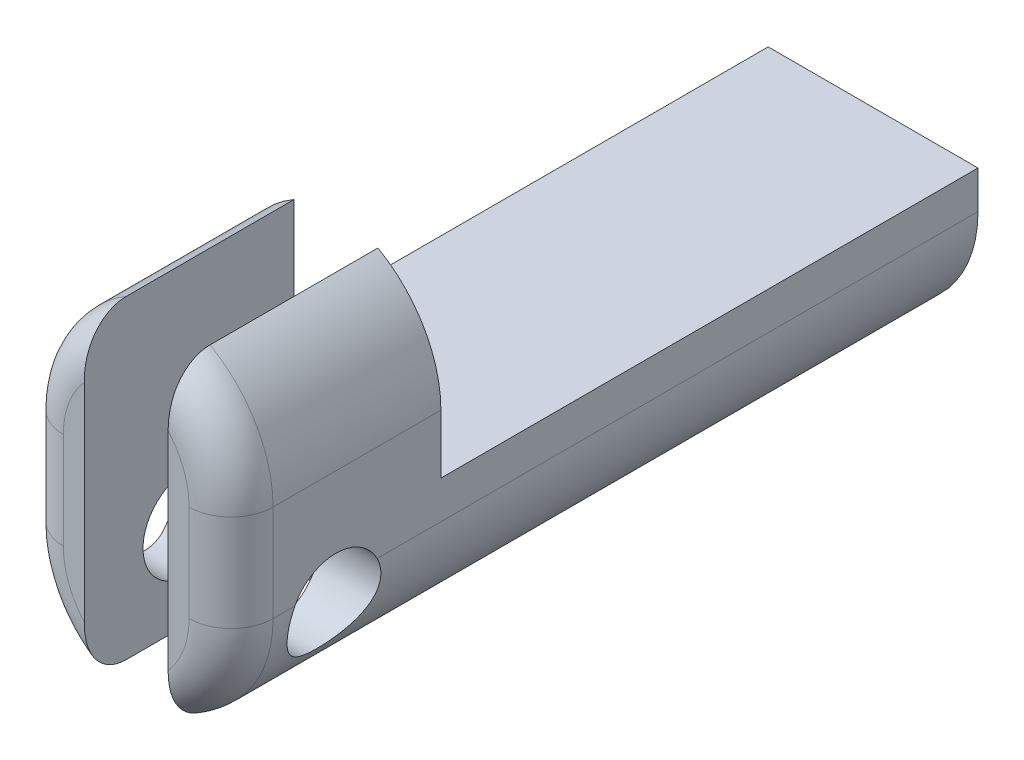
from build123d import *

# Parameters (mm, degrees)
SKETCH_1_W          = 5
SKETCH_1_H          = 3.9
EXTRUDE_1_DEPTH     = 12.8
SKETCH_2_R          = 1
CUT_EXTRUDE_1_DEPTH = 5
SKETCH_3_W          = 1.5
SKETCH_3_H          = 7.9
EXTRUDE_2_DEPTH     = 5
SKETCH_4_R          = 1.1
CUT_EXTRUDE_2_DEPTH = 5
FILLET_1_R          = 3
FILLET_2_R          = 3
FILLET_3_R          = 1


with BuildPart() as part:
    # 草图1 → 凸台-拉伸1 (new body)
    with BuildSketch(Plane.XY):
        Rectangle(SKETCH_1_W, SKETCH_1_H)
    extrude(amount=EXTRUDE_1_DEPTH)

    # 草图2 → 切除-拉伸1 (cut)
    with BuildSketch(Plane(origin=(0, 0, 0), x_dir=(-1, 0, 0), z_dir=(0, 0, -1))):
        with Locations((0, -0.05)):
            Circle(SKETCH_2_R)
    extrude(amount=-CUT_EXTRUDE_1_DEPTH, mode=Mode.SUBTRACT)

    # 草图3 → 凸台-拉伸2 (add)
    with BuildSketch(Plane.XY.offset(12.8)):
        with Locations((1.75, 2)):
            Rectangle(SKETCH_3_W, SKETCH_3_H)
        with Locations((-1.75, 2)):
            Rectangle(SKETCH_3_W, SKETCH_3_H)
    extrude(amount=EXTRUDE_2_DEPTH)

    # 草图4 → 切除-拉伸2 (cut)
    with BuildSketch(Plane(origin=(2.5, 0, 0), x_dir=(0, 0, -1), z_dir=(1, 0, 0))):
        with Locations(Location((-15.3, 0.55, 0), (0, 0, 90))):
            Circle(SKETCH_4_R)
    extrude(amount=-CUT_EXTRUDE_2_DEPTH, mode=Mode.SUBTRACT)

    # 圆角1
    # the kernel refuses this fillet: 3 mm, written as the material it takes off along each edge
    with BuildSketch(Plane(origin=(-2.5, -1.95, -7.5), x_dir=(0, 1, 0), z_dir=(0, 0, 1)), Plane(origin=(2.5, -1.95, 25.3), x_dir=(0, 1, 0), z_dir=(0, 0, -1))) as fillet_1_piece_1:
        with BuildLine():
            CenterArc((FILLET_1_R, -FILLET_1_R), FILLET_1_R, 90, 90)
            Line((0, -FILLET_1_R), (0, 0))
            Line((0, 0), (FILLET_1_R, 0))
        make_face()
    extrude(amount=32.8, mode=Mode.SUBTRACT)

    # 圆角2
    # the kernel refuses this fillet: 3 mm, written as the material it takes off along each edge
    with BuildSketch(Plane(origin=(2.5, 5.95, 6.304809472), x_dir=(0, -1, 0), z_dir=(0, 0, 1))) as fillet_2_piece_1:
        with BuildLine():
            CenterArc((2.598076211, -3), FILLET_2_R, 90, 60)
            Line((0, -1.5), (-0.051961524, -1.47))
            ThreePointArc((-0.051961524, -1.47), (-0.06, -0.75), (-0.06, 0))
            Line((-0.06, 0), (0, 0.06))
            Line((0, 0.06), (2.598076211, 0.06))
            Line((2.598076211, 0.06), (2.598076211, 0))
        make_face()
    extrude(amount=17.990381057, mode=Mode.SUBTRACT)
    with BuildSketch(Plane(origin=(-2.5, 5.95, 6.304809472), x_dir=(0, -1, 0), z_dir=(0, 0, 1))) as fillet_2_piece_2:
        with BuildLine():
            CenterArc((2.598076211, 3), FILLET_2_R, 210, 60)
            Line((0, 1.5), (-0.051961524, 1.47))
            ThreePointArc((-0.051961524, 1.47), (-0.06, 0.75), (-0.06, 0))
            Line((-0.06, 0), (0, -0.06))
            Line((0, -0.06), (2.598076211, -0.06))
            Line((2.598076211, -0.06), (2.598076211, 0))
        make_face()
    extrude(amount=17.990381057, mode=Mode.SUBTRACT)

    # 圆角3
    fillet_3_edges = [part.edges().sort_by_distance(p)[0] for p in [
        (-2.098076211, -0.45, 17.8),
        (2.5, 2.200961894, 17.8),
        (2.098076211, -0.45, 17.8),
        (2.098076211, 4.851923789, 17.8),
        (-2.5, 2.200961894, 17.8),
        (-2.098076211, 4.851923789, 17.8),
    ]]
    fillet(fillet_3_edges, radius=FILLET_3_R)


solid = part.part
